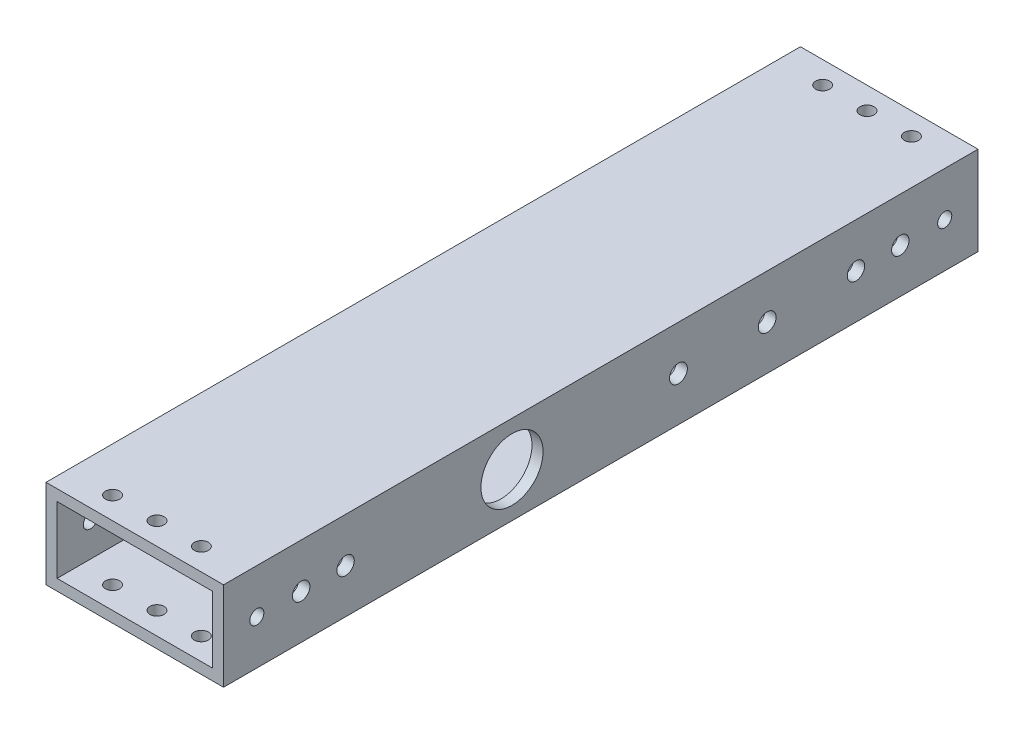
from build123d import *

# Parameters (mm, degrees)
SKETCH1_W           = 50.8
SKETCH1_H           = 25.4
SKETCH1_W_2         = 44.45
SKETCH1_H_2         = 19.05
BOSS_EXTRUDE1_DEPTH = 107.95
SKETCH2_R           = 2.0193
SKETCH2_R_2         = 2.4892
CUT_EXTRUDE1_DEPTH  = 120.979717036
SKETCH3_R           = 2.0193
CUT_EXTRUDE2_DEPTH  = 114.769602707
SKETCH4_R           = 8.89
SKETCH4_R_2         = 2.5527
CUT_EXTRUDE3_DEPTH  = 120.979717036
CUT_EXTRUDE4_REACH  = 115.77
SKETCH5_R           = 2.5527


with BuildPart() as part:
    # Sketch1 → Boss-Extrude1 (new, symmetric)
    with BuildSketch(Plane.XY):
        Rectangle(SKETCH1_W, SKETCH1_H)
        Rectangle(SKETCH1_W_2, SKETCH1_H_2, mode=Mode.SUBTRACT)
    extrude(amount=BOSS_EXTRUDE1_DEPTH, both=True)

    # Sketch2 → Cut-Extrude1 (cut, through all)
    with BuildSketch(Plane(origin=(25.4, 0, 0), x_dir=(0, 0, -1), z_dir=(1, 0, 0))):
        with Locations((-98.425, 0)):
            Circle(SKETCH2_R)
        with Locations((98.425, 0)):
            Circle(SKETCH2_R)
        with Locations((-85.725, 0)):
            Circle(SKETCH2_R_2)
        with Locations((-73.025, 0)):
            Circle(SKETCH2_R_2)
        with Locations((73.025, 0)):
            Circle(SKETCH2_R_2)
        with Locations((85.725, 0)):
            Circle(SKETCH2_R_2)
    extrude(amount=-CUT_EXTRUDE1_DEPTH, mode=Mode.SUBTRACT)

    # Sketch3 → Cut-Extrude2 (cut, through all)
    with BuildSketch(Plane(origin=(0, 12.7, 0), x_dir=(1, 0, 0), z_dir=(0, 1, 0))):
        with Locations((-12.7, -101.6)):
            Circle(SKETCH3_R)
        with Locations((0, -101.6)):
            Circle(SKETCH3_R)
        with Locations((12.7, -101.6)):
            Circle(SKETCH3_R)
        with Locations((12.7, 101.6)):
            Circle(SKETCH3_R)
        with Locations((0, 101.6)):
            Circle(SKETCH3_R)
        with Locations((-12.7, 101.6)):
            Circle(SKETCH3_R)
    extrude(amount=-CUT_EXTRUDE2_DEPTH, mode=Mode.SUBTRACT)

    # Sketch4 → Cut-Extrude3 (cut, through all)
    with BuildSketch(Plane(origin=(25.4, 0, 0), x_dir=(0, 0, -1), z_dir=(1, 0, 0))):
        with Locations((-25.4, 0)):
            Circle(SKETCH4_R)
        with Locations((47.625, 0)):
            Circle(SKETCH4_R_2)
        with Locations((22.225, 0)):
            Circle(SKETCH4_R_2)
    extrude(amount=-CUT_EXTRUDE3_DEPTH, mode=Mode.SUBTRACT)

    # Sketch5 → Cut-Extrude4 (cut, up to next)
    with BuildSketch(Plane.XZ.offset(12.7), mode=Mode.PRIVATE) as cut_extrude4_sk1:
        with Locations((-3.81, 63.5)):
            Circle(SKETCH5_R)
    cut_extrude4_tool1 = extrude(cut_extrude4_sk1.sketch, amount=-CUT_EXTRUDE4_REACH, mode=Mode.PRIVATE) & part.part
    # Sketch5 → Cut-Extrude4 (cut, up to next)
    with BuildSketch(Plane.XZ.offset(12.7), mode=Mode.PRIVATE) as cut_extrude4_sk2:
        with Locations((-16.51, 63.5)):
            Circle(SKETCH5_R)
    cut_extrude4_tool2 = extrude(cut_extrude4_sk2.sketch, amount=-CUT_EXTRUDE4_REACH, mode=Mode.PRIVATE) & part.part
    # Sketch5 → Cut-Extrude4 (cut, up to next)
    with BuildSketch(Plane.XZ.offset(12.7), mode=Mode.PRIVATE) as cut_extrude4_sk3:
        with Locations((-16.51, 50.8)):
            Circle(SKETCH5_R)
    cut_extrude4_tool3 = extrude(cut_extrude4_sk3.sketch, amount=-CUT_EXTRUDE4_REACH, mode=Mode.PRIVATE) & part.part
    # Sketch5 → Cut-Extrude4 (cut, up to next)
    with BuildSketch(Plane.XZ.offset(12.7), mode=Mode.PRIVATE) as cut_extrude4_sk4:
        with Locations((-3.81, 50.8)):
            Circle(SKETCH5_R)
    cut_extrude4_tool4 = extrude(cut_extrude4_sk4.sketch, amount=-CUT_EXTRUDE4_REACH, mode=Mode.PRIVATE) & part.part
    # Sketch5 → Cut-Extrude4 (cut, up to next)
    with BuildSketch(Plane.XZ.offset(12.7), mode=Mode.PRIVATE) as cut_extrude4_sk5:
        with Locations((-16.51, -12.7)):
            Circle(SKETCH5_R)
    cut_extrude4_tool5 = extrude(cut_extrude4_sk5.sketch, amount=-CUT_EXTRUDE4_REACH, mode=Mode.PRIVATE) & part.part
    # Sketch5 → Cut-Extrude4 (cut, up to next)
    with BuildSketch(Plane.XZ.offset(12.7), mode=Mode.PRIVATE) as cut_extrude4_sk6:
        with Locations((-3.81, -12.7)):
            Circle(SKETCH5_R)
    cut_extrude4_tool6 = extrude(cut_extrude4_sk6.sketch, amount=-CUT_EXTRUDE4_REACH, mode=Mode.PRIVATE) & part.part
    # Sketch5 → Cut-Extrude4 (cut, up to next)
    with BuildSketch(Plane.XZ.offset(12.7), mode=Mode.PRIVATE) as cut_extrude4_sk7:
        with Locations((-3.81, 0)):
            Circle(SKETCH5_R)
    cut_extrude4_tool7 = extrude(cut_extrude4_sk7.sketch, amount=-CUT_EXTRUDE4_REACH, mode=Mode.PRIVATE) & part.part
    # Sketch5 → Cut-Extrude4 (cut, up to next)
    with BuildSketch(Plane.XZ.offset(12.7), mode=Mode.PRIVATE) as cut_extrude4_sk8:
        with Locations((-16.51, 0)):
            Circle(SKETCH5_R)
    cut_extrude4_tool8 = extrude(cut_extrude4_sk8.sketch, amount=-CUT_EXTRUDE4_REACH, mode=Mode.PRIVATE) & part.part
    add(cut_extrude4_tool1.solids().sort_by_distance((-3.81, -12.7, 63.5))[0], mode=Mode.SUBTRACT)
    add(cut_extrude4_tool2.solids().sort_by_distance((-16.51, -12.7, 63.5))[0], mode=Mode.SUBTRACT)
    add(cut_extrude4_tool3.solids().sort_by_distance((-16.51, -12.7, 50.8))[0], mode=Mode.SUBTRACT)
    add(cut_extrude4_tool4.solids().sort_by_distance((-3.81, -12.7, 50.8))[0], mode=Mode.SUBTRACT)
    add(cut_extrude4_tool5.solids().sort_by_distance((-16.51, -12.7, -12.7))[0], mode=Mode.SUBTRACT)
    add(cut_extrude4_tool6.solids().sort_by_distance((-3.81, -12.7, -12.7))[0], mode=Mode.SUBTRACT)
    add(cut_extrude4_tool7.solids().sort_by_distance((-3.81, -12.7, 0))[0], mode=Mode.SUBTRACT)
    add(cut_extrude4_tool8.solids().sort_by_distance((-16.51, -12.7, 0))[0], mode=Mode.SUBTRACT)


solid = part.part
